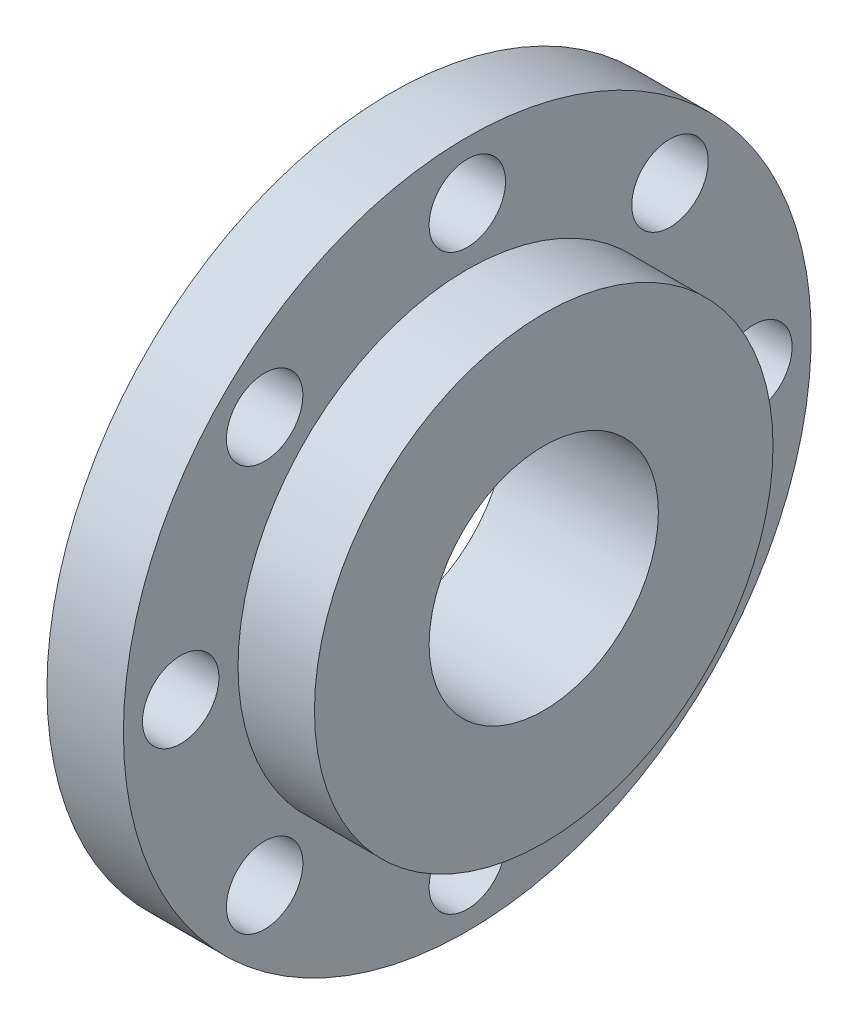
from build123d import *

# Parameters (mm, degrees)
SKETCH3_R          = 5
CUT_EXTRUDE1_DEPTH = 67.708320321


with BuildPart() as part:
    # Sketch2 → Revolve1 (revolve)
    with BuildSketch(Plane.XY):
        Polygon((0, 15), (20, 15), (20, 30), (10, 30), (10, 45), (0, 45), align=None)
    revolve(axis=Axis((0, 0, 0), (1, 0, 0)))

    # Sketch3 → Cut-Extrude1 (cut, through all)
    with BuildSketch(Plane.ZY):
        with Locations((0, 37.5)):
            Circle(SKETCH3_R)
        with Locations((26.516504294, 26.516504294)):
            Circle(SKETCH3_R)
        with Locations((37.5, 0)):
            Circle(SKETCH3_R)
        with Locations((26.516504294, -26.516504294)):
            Circle(SKETCH3_R)
        with Locations((0, -37.5)):
            Circle(SKETCH3_R)
        with Locations((-26.516504294, -26.516504294)):
            Circle(SKETCH3_R)
        with Locations((-37.5, 0)):
            Circle(SKETCH3_R)
        with Locations((-26.516504294, 26.516504294)):
            Circle(SKETCH3_R)
    extrude(amount=-CUT_EXTRUDE1_DEPTH, mode=Mode.SUBTRACT)


solid = part.part
